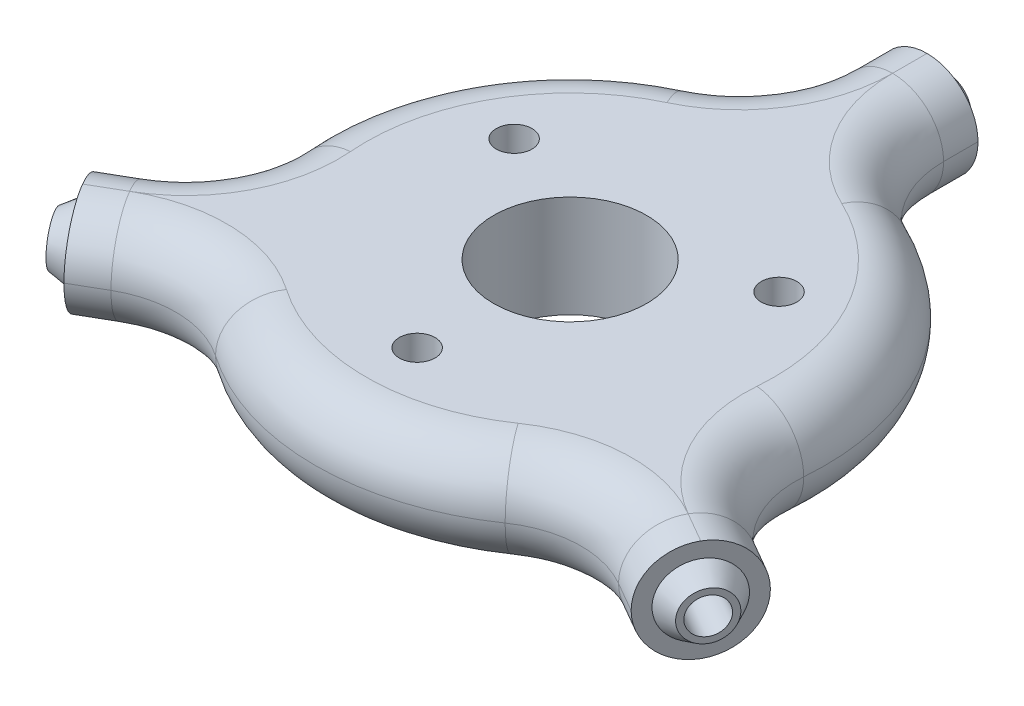
from build123d import *
from OCP.BRepFilletAPI import BRepFilletAPI_MakeChamfer

# Parameters (mm, degrees)
SKETCH1_R                      = 25
BOSS_EXTRUDE1_DEPTH            = 5
SKETCH2_W                      = 10
SKETCH2_H                      = 20
BOSS_EXTRUDE2_DEPTH            = 10
FILLET1_R                      = 10
FILLET2_R                      = 5
SKETCH3_R                      = 1.75
CUT_EXTRUDE1_DEPTH             = 20
SKETCH4_W                      = 5.7
SKETCH4_H                      = 3
CUT_EXTRUDE2_DEPTH             = 8
CIRPATTERN1_COUNT              = 3
SKETCH5_R                      = 1.75
CUT_EXTRUDE3_DEPTH             = 50.005657282
SKETCH7_R                      = 7.5
CUT_EXTRUDE5_DEPTH             = 50.005657282
SKETCH8_R                      = 3.5
BOSS_EXTRUDE3_DEPTH            = 2
CHAMFER1_SIZE2                 = 1.154700538
CHAMFER1_SIZE                  = 2
SKETCH9_R                      = 1.75
CUT_EXTRUDE6_DEPTH             = 2
CIRPATTERN2_COUNT              = 3
CHAMFER1_OF_CIRPATTERN2_SIZE   = 2
CHAMFER1_OF_CIRPATTERN2_SIZE_2 = 1.154700538
SKETCH10_R                     = 1.75
CUT_EXTRUDE7_DEPTH             = 2
SKETCH11_R                     = 1.75
CUT_EXTRUDE8_DEPTH             = 2
CUT_EXTRUDE9_DEPTH             = 3


with BuildPart() as part:
    # Sketch1 → Boss-Extrude1 (new, symmetric)
    with BuildSketch(Plane(origin=(0, 0, 0), x_dir=(1, 0, 0), z_dir=(0, 1, 0))):
        with Locations(Location((0, 0, 0), (0, 0, 270))):
            Circle(SKETCH1_R)
    extrude(amount=BOSS_EXTRUDE1_DEPTH, both=True)

    # Sketch2 → Boss-Extrude2 (add)
    with BuildSketch(Plane(origin=(0, 5, 0), x_dir=(1, 0, 0), z_dir=(0, 1, 0))):
        Polygon((15.490381057, -3.169872981), (10.490381057, -11.830127019), (27.810889132, -21.830127019), (32.810889132, -13.169872981), align=None)
        with Locations((0, 25)):
            Rectangle(SKETCH2_W, SKETCH2_H)
        Polygon((-10.490381057, -11.830127019), (-15.490381057, -3.169872981), (-32.810889132, -13.169872981), (-27.810889132, -21.830127019), align=None)
    extrude(amount=-BOSS_EXTRUDE2_DEPTH)

    # Fillet1
    fillet1_edges = [part.edges().sort_by_distance(p)[0] for p in [
        (5, 0, -24.494897428),
        (-5, 0, -24.494897428),
        (18.713203436, 0, 16.577575733),
        (23.713203436, 0, 7.917321695),
        (-23.713203436, 0, 7.917321695),
        (-18.713203436, 0, 16.577575733),
    ]]
    fillet(fillet1_edges, radius=FILLET1_R)

    # Fillet2
    fillet2_edges = [part.edges().sort_by_distance(p)[0] for p in [
        (-5, 5, -33.311388301),
        (-6.548457453, 5, -26.277551763),
        (-6.548457453, -5, -26.277551763),
        (-31.348508504, 5, 12.325567131),
        (-26.031256103, -5, 7.467645372),
        (-26.031256103, 5, 7.467645372),
        (31.348508504, 5, 12.325567131),
        (26.031256103, 5, 7.467645372),
        (26.031256103, -5, 7.467645372),
        (5, 5, -33.311388301),
        (6.548457453, -5, -26.277551763),
        (6.548457453, 5, -26.277551763),
        (-26.348508504, 5, 20.985821169),
        (-19.48279865, 5, 18.809906391),
        (-19.48279865, -5, 18.809906391),
        (26.348508504, 5, 20.985821169),
        (19.48279865, -5, 18.809906391),
        (19.48279865, 5, 18.809906391),
        (-21.650635095, 5, -12.5),
        (-21.650635095, -5, -12.5),
        (21.650635095, 5, -12.5),
        (21.650635095, -5, -12.5),
        (0, 5, 25),
        (0, -5, 25),
        (31.348508504, -5, 12.325567131),
        (5, -5, -33.311388301),
        (-26.348508504, -5, 20.985821169),
        (26.348508504, -5, 20.985821169),
        (-31.348508504, -5, 12.325567131),
        (-5, -5, -33.311388301),
    ]]
    fillet(fillet2_edges, radius=FILLET2_R - 0.0001)  # a hair under: the kernel refuses the full size

    # Sketch3 → Cut-Extrude1 (cut)
    with BuildSketch(Plane(origin=(0, 0, -35), x_dir=(-1, 0, 0), z_dir=(0, 0, -1))):
        Circle(SKETCH3_R)
    cut_extrude1 = extrude(amount=-CUT_EXTRUDE1_DEPTH, mode=Mode.SUBTRACT)

    # Sketch4 → Cut-Extrude2 (cut)
    with BuildSketch(Plane.XZ.offset(5)):
        with Locations((0, -20)):
            Rectangle(SKETCH4_W, SKETCH4_H)
    cut_extrude2 = extrude(amount=-CUT_EXTRUDE2_DEPTH, mode=Mode.SUBTRACT)

    # CirPattern1: Cut-Extrude1, Cut-Extrude2 ×3 about axis
    cirpattern1_axis = Axis((0, 0, 0), (0, 1, 0))
    add([cut_extrude1.rotate(cirpattern1_axis, i * 360 / CIRPATTERN1_COUNT) for i in range(1, CIRPATTERN1_COUNT)], mode=Mode.SUBTRACT)
    add([cut_extrude2.rotate(cirpattern1_axis, i * 360 / CIRPATTERN1_COUNT) for i in range(1, CIRPATTERN1_COUNT)], mode=Mode.SUBTRACT)

    # Sketch5 → Cut-Extrude3 (cut, through all)
    with BuildSketch(Plane(origin=(0, 5, 0), x_dir=(1, 0, 0), z_dir=(0, 1, 0))):
        with Locations(Location((-12.990381057, 7.5, 0), (0, 0, 270))):
            Circle(SKETCH5_R)
        with Locations(Location((12.990381057, 7.5, 0), (0, 0, 270))):
            Circle(SKETCH5_R)
        with Locations(Location((0, -15, 0), (0, 0, 270))):
            Circle(SKETCH5_R)
    extrude(amount=-CUT_EXTRUDE3_DEPTH, mode=Mode.SUBTRACT)

    # Sketch7 → Cut-Extrude5 (cut, through all)
    with BuildSketch(Plane(origin=(0, 5, 0), x_dir=(1, 0, 0), z_dir=(0, 1, 0))):
        with Locations(Location((0, 0, 0), (0, 0, 270))):
            Circle(SKETCH7_R)
    extrude(amount=-CUT_EXTRUDE5_DEPTH, mode=Mode.SUBTRACT)

    # Sketch8 → Boss-Extrude3 (add)
    with BuildSketch(Plane(origin=(30.310889132, 0, 17.5), x_dir=(0.4999999999999999, 0, -0.8660254037844386), z_dir=(0.8660254037844387, 0, 0.49999999999999994))):
        Circle(SKETCH8_R)
    boss_extrude3 = extrude(amount=BOSS_EXTRUDE3_DEPTH)

    # Chamfer1
    chamfer1_edges = [part.edges().sort_by_distance(p)[0] for p in [
        (30.29293994, 0, 21.531088913),
    ]]
    chamfer1_side = [part.faces().sort_by_distance(p)[0] for p in [
        (30.27293994, 0, 21.519541908),
    ]]
    chamfer(chamfer1_edges, length=CHAMFER1_SIZE - 0.0001, length2=CHAMFER1_SIZE2 - 0.0001, reference=chamfer1_side[0])  # a hair under: the kernel refuses the full size

    # Sketch9 → Cut-Extrude6 (cut)
    with BuildSketch(Plane(origin=(32.04293994, 0, 18.5), x_dir=(0.49999999999999983, 0, -0.8660254037844387), z_dir=(0.8660254037844387, 0, 0.49999999999999983))):
        Circle(SKETCH9_R)
    extrude(amount=-CUT_EXTRUDE6_DEPTH, mode=Mode.SUBTRACT)

    # CirPattern2: Boss-Extrude3 ×3 about axis
    cirpattern2_axis = Axis((0, 0, 0), (0, 1, 0))
    for i in range(1, CIRPATTERN2_COUNT):
        add(boss_extrude3.rotate(cirpattern2_axis, i * 360 / CIRPATTERN2_COUNT))

    # Chamfer1 of CirPattern2
    chamfer1_of_cirpattern2_edges_1 = [part.edges().sort_by_distance(p)[0] for p in [
        (3.5, 0, -37),
    ]]
    chamfer1_of_cirpattern2_side_1 = [part.faces().sort_by_distance(p)[0] for p in [
        (3.5, 0, -36.976905989),
    ]]
    chamfer1_of_cirpattern2_edges_2 = [part.edges().sort_by_distance(p)[0] for p in [
        (-33.79293994, 0, 15.468911087),
    ]]
    chamfer1_of_cirpattern2_side_2 = [part.faces().sort_by_distance(p)[0] for p in [
        (-33.77293994, 0, 15.457364081),
    ]]
    chamfer1_of_cirpattern2 = BRepFilletAPI_MakeChamfer(part.part.solid().wrapped)
    for e in chamfer1_of_cirpattern2_edges_1:
        chamfer1_of_cirpattern2.Add(CHAMFER1_OF_CIRPATTERN2_SIZE - 0.0001, CHAMFER1_OF_CIRPATTERN2_SIZE_2 - 0.0001, e.wrapped, chamfer1_of_cirpattern2_side_1[0].wrapped)
    for e in chamfer1_of_cirpattern2_edges_2:
        chamfer1_of_cirpattern2.Add(CHAMFER1_OF_CIRPATTERN2_SIZE - 0.0001, CHAMFER1_OF_CIRPATTERN2_SIZE_2 - 0.0001, e.wrapped, chamfer1_of_cirpattern2_side_2[0].wrapped)
    add(Compound.cast(chamfer1_of_cirpattern2.Shape()), mode=Mode.REPLACE)  # a hair under: the kernel refuses the full size

    # Sketch10 → Cut-Extrude7 (cut)
    with BuildSketch(Plane(origin=(-32.04293994, 0, 18.5), x_dir=(0.4999999999999961, 0, 0.8660254037844409), z_dir=(-0.8660254037844409, 0, 0.4999999999999961))):
        Circle(SKETCH10_R)
    extrude(amount=-CUT_EXTRUDE7_DEPTH, mode=Mode.SUBTRACT)

    # Sketch11 → Cut-Extrude8 (cut)
    with BuildSketch(Plane(origin=(0, 0, -37), x_dir=(-1, 0, 0), z_dir=(0, 0, -1))):
        Circle(SKETCH11_R)
    extrude(amount=-CUT_EXTRUDE8_DEPTH, mode=Mode.SUBTRACT)

    # Sketch12 → Cut-Extrude9 (cut)
    with BuildSketch(Plane.XZ.offset(5)):
        Polygon((12.990381057, -10.790896534), (15.840381057, -9.145448267), (15.840381057, -5.854551733), (12.990381057, -4.209103466), (10.140381057, -5.854551733), (10.140381057, -9.145448267), align=None)
        Polygon((-15.840381057, -5.854551733), (-15.840381057, -9.145448267), (-12.990381057, -10.790896534), (-10.140381057, -9.145448267), (-10.140381057, -5.854551733), (-12.990381057, -4.209103466), align=None)
        Polygon((2.85, 16.645448267), (0, 18.290896534), (-2.85, 16.645448267), (-2.85, 13.354551733), (0, 11.709103466), (2.85, 13.354551733), align=None)
    extrude(amount=-CUT_EXTRUDE9_DEPTH, mode=Mode.SUBTRACT)


solid = part.part
